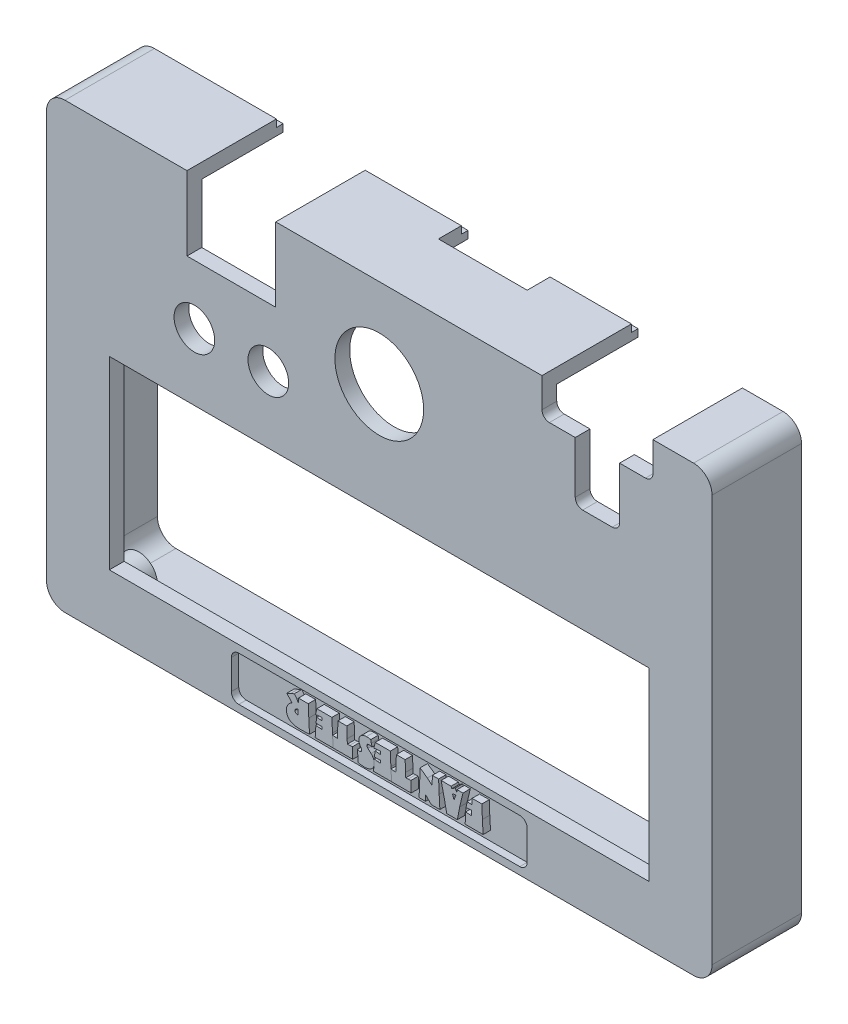
from build123d import *

# Parameters (mm, degrees)
SKETCH_1_W           = 90
SKETCH_1_H           = 60
EXTRUDE_1_DEPTH      = 2
SKETCH_8_W           = 2
SKETCH_8_H           = 60
EXTRUDE_8_DEPTH      = 11
SKETCH_9_W           = 88
SKETCH_9_H           = 2
EXTRUDE_9_DEPTH      = 11
SKETCH_10_W          = 2
SKETCH_10_H          = 58
EXTRUDE_10_DEPTH     = 11
SKETCH_11_W          = 86
SKETCH_11_H          = 2
EXTRUDE_11_DEPTH     = 11
SKETCH_12_W          = 0.8
SKETCH_12_H          = 60
EXTRUDE_12_DEPTH     = 1
SKETCH_23_W          = 90
SKETCH_23_H          = 1
CUT_EXTRUDE_8_DEPTH  = 0.9
SKETCH_24_W          = 1
SKETCH_24_H          = 59
CUT_EXTRUDE_9_DEPTH  = 0.9
SKETCH_25_W          = 89
SKETCH_25_H          = 1
CUT_EXTRUDE_10_DEPTH = 0.9
SKETCH_26_W          = 1
SKETCH_26_H          = 58
CUT_EXTRUDE_11_DEPTH = 0.9
SKETCH_27_W          = 15
SKETCH_27_H          = 13
CUT_EXTRUDE_12_DEPTH = 5
SKETCH_28_W          = 12
SKETCH_28_H          = 4
CUT_EXTRUDE_13_DEPTH = 20
SKETCH_29_W          = 12
SKETCH_29_H          = 13
CUT_EXTRUDE_14_DEPTH = 10
SKETCH_30_W          = 73
SKETCH_30_H          = 25
CUT_EXTRUDE_15_DEPTH = 10
SKETCH_31_R          = 2.5
EXTRUDE_22_DEPTH     = 3
SKETCH_32_R          = 1.4
CUT_EXTRUDE_16_DEPTH = 3
FILLET_4_R           = 2.5
FILLET_5_R           = 2.5
SKETCH_33_R          = 6
CUT_EXTRUDE_17_DEPTH = 5
SKETCH_34_R          = 2.75
CUT_EXTRUDE_18_DEPTH = 5
SKETCH_35_W          = 6
SKETCH_35_H          = 8
CUT_EXTRUDE_19_DEPTH = 5
FILLET_9_R           = 1
SKETCH_36_W          = 40
SKETCH_36_H          = 6
CUT_EXTRUDE_20_DEPTH = 1
FILLET_10_R          = 1
EXTRUDE_24_DEPTH     = 1
EXTRUDE_24_2_DEPTH   = 1
EXTRUDE_24_3_DEPTH   = 1
EXTRUDE_24_4_DEPTH   = 1
EXTRUDE_24_5_DEPTH   = 1
EXTRUDE_24_6_DEPTH   = 1
EXTRUDE_24_7_DEPTH   = 1
EXTRUDE_24_8_DEPTH   = 1
EXTRUDE_24_9_DEPTH   = 1


with BuildPart() as part:
    # Эскиз1 → Бобышка-Вытянуть1 (new body)
    with BuildSketch(Plane.XY):
        with Locations((11.347826087, -8.739130435)):
            Rectangle(SKETCH_1_W, SKETCH_1_H)
    extrude(amount=EXTRUDE_1_DEPTH)

    # Эскиз8 → Бобышка-Вытянуть8 (add)
    with BuildSketch(Plane(origin=(0, 0, 0), x_dir=(-1, 0, 0), z_dir=(0, 0, -1))):
        with Locations((-55.347826087, -8.739130435)):
            Rectangle(SKETCH_8_W, SKETCH_8_H)
    extrude(amount=EXTRUDE_8_DEPTH)

    # Эскиз9 → Бобышка-Вытянуть9 (add)
    with BuildSketch(Plane(origin=(0, 0, 0), x_dir=(-1, 0, 0), z_dir=(0, 0, -1))):
        with Locations((-10.347826087, -37.739130435)):
            Rectangle(SKETCH_9_W, SKETCH_9_H)
    extrude(amount=EXTRUDE_9_DEPTH)

    # Эскиз10 → Бобышка-Вытянуть10 (add)
    with BuildSketch(Plane(origin=(0, 0, 0), x_dir=(-1, 0, 0), z_dir=(0, 0, -1))):
        with Locations((32.652173913, -7.739130435)):
            Rectangle(SKETCH_10_W, SKETCH_10_H)
    extrude(amount=EXTRUDE_10_DEPTH)

    # Эскиз11 → Бобышка-Вытянуть11 (add)
    with BuildSketch(Plane(origin=(0, 0, 0), x_dir=(-1, 0, 0), z_dir=(0, 0, -1))):
        with Locations((-11.347826087, 20.260869565)):
            Rectangle(SKETCH_11_W, SKETCH_11_H)
    extrude(amount=EXTRUDE_11_DEPTH)

    # Эскиз12 → Бобышка-Вытянуть12 (add)
    with BuildSketch(Plane(origin=(0, 0, -11), x_dir=(-1, 0, 0), z_dir=(0, 0, -1))):
        with Locations((-55.947826087, -8.739130435)):
            Rectangle(SKETCH_12_W, SKETCH_12_H)
    extrude(amount=-EXTRUDE_12_DEPTH)

    # Эскиз23 → Вырез-Вытянуть8 (cut)
    with BuildSketch(Plane(origin=(0, 0, -11), x_dir=(-1, 0, 0), z_dir=(0, 0, -1))):
        with Locations((-11.347826087, 20.760869565)):
            Rectangle(SKETCH_23_W, SKETCH_23_H)
    extrude(amount=-CUT_EXTRUDE_8_DEPTH, mode=Mode.SUBTRACT)

    # Эскиз24 → Вырез-Вытянуть9 (cut)
    with BuildSketch(Plane(origin=(0, 0, -11), x_dir=(-1, 0, 0), z_dir=(0, 0, -1))):
        with Locations((33.152173913, -9.239130435)):
            Rectangle(SKETCH_24_W, SKETCH_24_H)
    extrude(amount=-CUT_EXTRUDE_9_DEPTH, mode=Mode.SUBTRACT)

    # Эскиз25 → Вырез-Вытянуть10 (cut)
    with BuildSketch(Plane(origin=(0, 0, -11), x_dir=(-1, 0, 0), z_dir=(0, 0, -1))):
        with Locations((-11.847826087, -38.239130435)):
            Rectangle(SKETCH_25_W, SKETCH_25_H)
    extrude(amount=-CUT_EXTRUDE_10_DEPTH, mode=Mode.SUBTRACT)

    # Эскиз26 → Вырез-Вытянуть11 (cut)
    with BuildSketch(Plane(origin=(0, 0, -11), x_dir=(-1, 0, 0), z_dir=(0, 0, -1))):
        with Locations((-55.847826087, -8.739130435)):
            Rectangle(SKETCH_26_W, SKETCH_26_H)
    extrude(amount=-CUT_EXTRUDE_11_DEPTH, mode=Mode.SUBTRACT)

    # Эскиз27 → Вырез-Вытянуть12 (cut)
    with BuildSketch(Plane(origin=(0, 21.260869565, 0), x_dir=(1, 0, 0), z_dir=(0, 1, 0))):
        with Locations((40.847826087, 4.5)):
            Rectangle(SKETCH_27_W, SKETCH_27_H)
    extrude(amount=-CUT_EXTRUDE_12_DEPTH, mode=Mode.SUBTRACT)

    # Эскиз28 → Вырез-Вытянуть13 (cut)
    with BuildSketch(Plane(origin=(0, 21.260869565, 0), x_dir=(1, 0, 0), z_dir=(0, 1, 0))):
        with Locations((16.347826087, 9)):
            Rectangle(SKETCH_28_W, SKETCH_28_H)
    extrude(amount=-CUT_EXTRUDE_13_DEPTH, mode=Mode.SUBTRACT)

    # Эскиз29 → Вырез-Вытянуть14 (cut)
    with BuildSketch(Plane(origin=(0, 21.260869565, 0), x_dir=(1, 0, 0), z_dir=(0, 1, 0))):
        with Locations((-8.652173913, 4.5)):
            Rectangle(SKETCH_29_W, SKETCH_29_H)
    extrude(amount=-CUT_EXTRUDE_14_DEPTH, mode=Mode.SUBTRACT)

    # Эскиз30 → Вырез-Вытянуть15 (cut)
    with BuildSketch(Plane.XY.offset(2)):
        with Locations((11.347826087, -18.239130435)):
            Rectangle(SKETCH_30_W, SKETCH_30_H)
    extrude(amount=-CUT_EXTRUDE_15_DEPTH, mode=Mode.SUBTRACT)

    # Эскиз31 → Бобышка-Вытянуть22 (add)
    with BuildSketch(Plane(origin=(0, 0, 0), x_dir=(-1, 0, 0), z_dir=(0, 0, -1))):
        with Locations(Location((26.152173913, -34.139130435, 0), (0, 0, 180))):
            Circle(SKETCH_31_R)
        with Locations(Location((-48.847826087, -34.139130435, 0), (0, 0, 180))):
            Circle(SKETCH_31_R)
        with Locations(Location((26.152173913, -2.739130435, 0), (0, 0, 180))):
            Circle(SKETCH_31_R)
        with Locations(Location((-48.847826087, -2.739130435, 0), (0, 0, 180))):
            Circle(SKETCH_31_R)
    extrude(amount=EXTRUDE_22_DEPTH)

    # Эскиз32 → Вырез-Вытянуть16 (cut)
    with BuildSketch(Plane(origin=(0, 0, -3), x_dir=(-1, 0, 0), z_dir=(0, 0, -1))):
        with Locations((26.152173913, -34.139130435)):
            Circle(SKETCH_32_R)
        with Locations((-48.847826087, -34.139130435)):
            Circle(SKETCH_32_R)
        with Locations((-48.847826087, -2.739130435)):
            Circle(SKETCH_32_R)
        with Locations((26.152173913, -2.739130435)):
            Circle(SKETCH_32_R)
    extrude(amount=-CUT_EXTRUDE_16_DEPTH, mode=Mode.SUBTRACT)

    # Скругление4
    fillet_4_edges = [part.edges().sort_by_distance(p)[0] for p in [
        (54.347826087, -36.739130435, -5.5),
        (-31.652173913, -36.739130435, -5.5),
        (54.347826087, 19.260869565, -5.5),
        (-31.652173913, 19.260869565, -5.5),
        (-33.652173913, 21.260869565, -4.05),
        (56.347826087, 21.260869565, -4.05),
        (56.347826087, -38.739130435, -4.05),
        (-33.652173913, -38.739130435, -4.05),
    ]]
    fillet(fillet_4_edges, radius=FILLET_4_R)

    # Скругление5
    fillet_5_edges = [part.edges().sort_by_distance(p)[0] for p in [
        (-32.652173913, 20.260869565, -10.55),
        (-32.652173913, -37.739130435, -10.55),
        (55.347826087, 20.260869565, -10.55),
        (55.347826087, -37.739130435, -10.55),
    ]]
    fillet(fillet_5_edges, radius=FILLET_5_R)

    # Эскиз33 → Вырез-Вытянуть17 (cut)
    with BuildSketch(Plane.XY.offset(2)):
        with Locations((11.347826087, 9.260869565)):
            Circle(SKETCH_33_R)
    extrude(amount=-CUT_EXTRUDE_17_DEPTH, mode=Mode.SUBTRACT)

    # Эскиз34 → Вырез-Вытянуть18 (cut)
    with BuildSketch(Plane.XY.offset(2)):
        with Locations((-3.652173913, 3.260869565)):
            Circle(SKETCH_34_R)
        with Locations((-13.652173913, 3.260869565)):
            Circle(SKETCH_34_R)
    extrude(amount=-CUT_EXTRUDE_18_DEPTH, mode=Mode.SUBTRACT)

    # Эскиз35 → Вырез-Вытянуть19 (cut)
    with BuildSketch(Plane.XY.offset(2)):
        with Locations((40.847826087, 12.260869565)):
            Rectangle(SKETCH_35_W, SKETCH_35_H)
    extrude(amount=-CUT_EXTRUDE_19_DEPTH, mode=Mode.SUBTRACT)

    # Скругление9
    fillet_9_edges = [part.edges().sort_by_distance(p)[0] for p in [
        (48.347826087, 16.260869565, 1),
        (33.347826087, 16.260869565, 1),
        (43.847826087, 8.260869565, 1),
        (37.847826087, 8.260869565, 1),
    ]]
    fillet(fillet_9_edges, radius=FILLET_9_R)

    # Эскиз36 → Вырез-Вытянуть20 (cut)
    with BuildSketch(Plane.XY.offset(2)):
        with Locations((11.347826087, -34.739130435)):
            Rectangle(SKETCH_36_W, SKETCH_36_H)
    extrude(amount=-CUT_EXTRUDE_20_DEPTH, mode=Mode.SUBTRACT)

    # Скругление10
    fillet_10_edges = [part.edges().sort_by_distance(p)[0] for p in [
        (31.347826087, -31.739130435, 1.5),
        (31.347826087, -37.739130435, 1.5),
        (-8.652173913, -37.739130435, 1.5),
        (-8.652173913, -31.739130435, 1.5),
    ]]
    fillet(fillet_10_edges, radius=FILLET_10_R)


with BuildPart() as body_2:
    # Бобышка-Вытянуть24: read off the stored shape, not the designer's step
    # Бобышка-Вытянуть24 outline → Бобышка-Вытянуть24 (new body)
    with BuildSketch(Plane.XY.offset(1)):
        with BuildLine():
            Line((23.05076574, -34.971281843), (22.960064521, -36.465184282))
            Line((22.960064521, -36.465184282), (25.39299135, -36.465184282))
            add(Edge.make_bspline(
                [(25.291619399, -34.748530318), (25.293236653, -34.801223513), (25.296635801, -34.911974158), (25.30534041, -35.085995763), (25.314058626, -35.276124742), (25.326798719, -35.482362723), (25.339508144, -35.705181218), (25.356143815, -35.94409354), (25.37296666, -36.199369208), (25.386176061, -36.374715638), (25.39299135, -36.465184282)],
                knots=[0, 0, 0, 0, 0.091960342, 0.193282399, 0.303937941, 0.423970493, 0.553726848, 0.693256889, 0.841738249, 1, 1, 1, 1], degree=3))
            Line((25.291619399, -34.748530318), (25.220925801, -32.965184282))
            Line((25.220925801, -32.965184282), (23.901089673, -32.965184282))
            Line((23.901089673, -32.965184282), (23.883749734, -33.735477727))
            add(Edge.make_bspline(
                [(23.6156476, -33.724806995), (23.642983947, -33.726724268), (23.69451953, -33.730338788), (23.766579743, -33.733318664), (23.828600451, -33.735890131), (23.866407815, -33.735607409), (23.883749734, -33.735477727)],
                knots=[0, 0, 0, 0, 0.306294033, 0.57743785, 0.806174296, 1, 1, 1, 1], degree=3))
            add(Edge.make_bspline(
                [(23.225498972, -33.684791751), (23.252182635, -33.687166768), (23.309360947, -33.692256005), (23.400893179, -33.701970465), (23.504319147, -33.712356403), (23.577196573, -33.720506764), (23.6156476, -33.724806995)],
                knots=[0, 0, 0, 0, 0.204909238, 0.439083791, 0.704053702, 1, 1, 1, 1], degree=3))
            add(Edge.make_bspline(
                [(23.162808423, -34.05760044), (23.167240568, -34.032477476), (23.176809618, -33.978236723), (23.192522429, -33.891007141), (23.207944236, -33.791685875), (23.219440114, -33.721685289), (23.225498972, -33.684791751)],
                knots=[0, 0, 0, 0, 0.202441277, 0.437072922, 0.703311467, 1, 1, 1, 1], degree=3))
            add(Edge.make_bspline(
                [(23.088113301, -34.449749831), (23.092961718, -34.422176188), (23.10329214, -34.363425591), (23.120576559, -34.270486772), (23.140754286, -34.167366889), (23.155216608, -34.09538594), (23.162808423, -34.05760044)],
                knots=[0, 0, 0, 0, 0.210387918, 0.448269241, 0.710375835, 1, 1, 1, 1], degree=3))
            add(Edge.make_bspline(
                [(23.851070618, -34.414403032), (23.83550864, -34.414336065), (23.799711206, -34.414182019), (23.739234159, -34.415718067), (23.664780833, -34.418689509), (23.576480852, -34.421506559), (23.474052022, -34.427577265), (23.357724754, -34.432905418), (23.227513584, -34.441541702), (23.13613514, -34.446922222), (23.088113301, -34.449749831)],
                knots=[0, 0, 0, 0, 0.061114662, 0.140582909, 0.237556205, 0.353756089, 0.487517756, 0.64050633, 0.811076376, 1, 1, 1, 1], degree=3))
            Line((23.851070618, -34.414403032), (23.817057661, -35.056647696))
            add(Edge.make_bspline(
                [(23.510941045, -35.04130852), (23.562947759, -35.044683352), (23.664911587, -35.051300013), (23.767026515, -35.054889184), (23.817057661, -35.056647696)],
                knots=[0, 0, 0, 0, 0.510050625, 1, 1, 1, 1], degree=3))
            add(Edge.make_bspline(
                [(23.05076574, -34.971281843), (23.082125776, -34.975628469), (23.14958169, -34.984978128), (23.257475802, -35.002194311), (23.379610224, -35.020515387), (23.465600388, -35.034129898), (23.510941045, -35.04130852)],
                knots=[0, 0, 0, 0, 0.204041418, 0.438896198, 0.704142728, 1, 1, 1, 1], degree=3))
        make_face()
    extrude(amount=EXTRUDE_24_DEPTH)


with BuildPart() as body_3:
    # Extrude 24 2 outline → Extrude 24 2 (new body)
    with BuildSketch(Plane.XY.offset(1)):
        with BuildLine():
            add(Edge.make_bspline(
                [(20.129652935, -34.803884739), (20.116766445, -34.745861035), (20.089754464, -34.624234808), (20.047321155, -34.43388352), (20.000142174, -34.228016288), (19.951373856, -34.005872753), (19.896754136, -33.768511569), (19.840522718, -33.51465659), (19.779682296, -33.245254151), (19.737740853, -33.060328227), (19.716162082, -32.965184282)],
                knots=[0, 0, 0, 0, 0.0946144, 0.198325714, 0.310443765, 0.430813265, 0.560357588, 0.698153136, 0.84470051, 1, 1, 1, 1], degree=3))
            add(Edge.make_bspline(
                [(20.477785557, -36.465184282), (20.474722142, -36.448057459), (20.468150466, -36.411316794), (20.456595261, -36.352932946), (20.444195001, -36.287477247), (20.429183913, -36.215339131), (20.413224848, -36.135966318), (20.396148352, -36.049390115), (20.376532599, -35.956122645), (20.355996607, -35.855787506), (20.333336441, -35.748408467), (20.308369917, -35.634299507), (20.283506952, -35.512675141), (20.25489607, -35.384675323), (20.226759575, -35.249079311), (20.195853555, -35.106850672), (20.16313973, -34.957738981), (20.140975892, -34.855907783), (20.129652935, -34.803884739)],
                knots=[0, 0, 0, 0, 0.030749035, 0.065963194, 0.105184053, 0.148488334, 0.196184446, 0.24827254, 0.304445785, 0.364625718, 0.429277235, 0.498401387, 0.571066046, 0.648669869, 0.730197602, 0.815813943, 0.905903893, 1, 1, 1, 1], degree=3))
            Line((20.477785557, -36.465184282), (21.908330527, -36.465184282))
            add(Edge.make_bspline(
                [(22.219115588, -34.825893123), (22.189694228, -34.965440029), (22.131338089, -35.242225962), (22.049797818, -35.654967212), (21.975808037, -36.061919478), (21.930695565, -36.33152445), (21.908330527, -36.465184282)],
                knots=[0, 0, 0, 0, 0.256398193, 0.508555978, 0.756360854, 1, 1, 1, 1], degree=3))
            add(Edge.make_bspline(
                [(22.661284033, -32.965184282), (22.654994714, -32.990956492), (22.641993674, -33.04423182), (22.623120729, -33.127147101), (22.601258906, -33.214950524), (22.579679801, -33.308252471), (22.55611615, -33.406459542), (22.531538569, -33.509855682), (22.505356677, -33.618247796), (22.478956205, -33.732240239), (22.449981437, -33.850997905), (22.420927031, -33.97516715), (22.390025989, -34.104274449), (22.357978885, -34.238487223), (22.325663216, -34.37828722), (22.290486931, -34.522785805), (22.255544311, -34.672769264), (22.23138322, -34.774327572), (22.219115588, -34.825893123)],
                knots=[0, 0, 0, 0, 0.041612251, 0.086019254, 0.133382434, 0.183539943, 0.236233463, 0.291802359, 0.350246648, 0.411146484, 0.475341601, 0.541992028, 0.611178524, 0.683579621, 0.758436527, 0.836249204, 0.91685663, 1, 1, 1, 1], degree=3))
            Line((22.661284033, -32.965184282), (21.870316045, -32.965184282))
            Line((21.870316045, -32.965184282), (21.810293179, -33.402017361))
            add(Edge.make_bspline(
                [(21.78361635, -33.197939617), (21.789421973, -33.212017247), (21.801557549, -33.241443911), (21.810878872, -33.290448921), (21.814160469, -33.344662677), (21.811626855, -33.382237988), (21.810293179, -33.402017361)],
                knots=[0, 0, 0, 0, 0.218990593, 0.457759064, 0.714568282, 1, 1, 1, 1], degree=3))
            Line((21.78361635, -33.197939617), (21.621554612, -32.901159892))
            add(Edge.make_bspline(
                [(21.301432661, -33.119909892), (21.320770649, -33.106789828), (21.364345003, -33.077226344), (21.437226925, -33.027926369), (21.524356289, -32.967778621), (21.587527641, -32.924481627), (21.621554612, -32.901159892)],
                knots=[0, 0, 0, 0, 0.180813759, 0.407428244, 0.680813825, 1, 1, 1, 1], degree=3))
            add(Edge.make_bspline(
                [(21.133970284, -33.232988478), (21.13420907, -33.23263586), (21.137665707, -33.227772388), (21.146398113, -33.220716735), (21.16317374, -33.205571064), (21.188343989, -33.190135163), (21.219164406, -33.168954483), (21.25794602, -33.145696721), (21.286084631, -33.129011009), (21.301432661, -33.119909892)],
                knots=[0.057959926, 0.057959926, 0.057959926, 0.057959926, 0.06301111, 0.12883402, 0.230143345, 0.368701917, 0.543404953, 0.750953076, 1, 1, 1, 1], degree=3))
            Line((21.133970284, -33.232988478), (21.058006594, -32.965184282))
            Line((21.058006594, -32.965184282), (19.716162082, -32.965184282))
        make_face()
        with BuildLine():
            add(Edge.make_bspline(
                [(21.498174277, -33.713469343), (21.453377594, -33.71950414), (21.365134341, -33.731391854), (21.278206457, -33.750664772), (21.235407508, -33.760153794)],
                knots=[0, 0, 0, 0, 0.50764995, 1, 1, 1, 1], degree=3))
            add(Edge.make_bspline(
                [(21.701065036, -33.692365644), (21.699686371, -33.692437287), (21.689196199, -33.691399274), (21.680971143, -33.695412875), (21.656735916, -33.695797622), (21.628770452, -33.700017111), (21.591659317, -33.703651465), (21.54757246, -33.708477675), (21.515528534, -33.711715702), (21.498174277, -33.713469343)],
                knots=[0.018867888, 0.018867888, 0.018867888, 0.018867888, 0.037075841, 0.105681148, 0.209625671, 0.352841246, 0.531771228, 0.746418023, 1, 1, 1, 1], degree=3))
            add(Edge.make_bspline(
                [(21.565533271, -34.090946477), (21.575344196, -34.063168471), (21.596276355, -34.003902534), (21.628907973, -33.90947862), (21.664020029, -33.804308924), (21.688362683, -33.730751412), (21.701065036, -33.692365644)],
                knots=[0, 0, 0, 0, 0.209101977, 0.446130815, 0.709093978, 0.996083324, 0.996083324, 0.996083324, 0.996083324], degree=3))
            add(Edge.make_bspline(
                [(21.46482824, -34.484429709), (21.46458413, -34.474858457), (21.464048497, -34.453856965), (21.469003202, -34.419347152), (21.476134281, -34.379050493), (21.487167522, -34.33283768), (21.501045891, -34.280691376), (21.519436511, -34.222825849), (21.540558893, -34.158636689), (21.556939851, -34.114237964), (21.565533271, -34.090946477)],
                knots=[0, 0, 0, 0, 0.070273521, 0.154196003, 0.255494251, 0.37125073, 0.503262761, 0.652133715, 0.817510001, 1, 1, 1, 1], degree=3))
            add(Edge.make_bspline(
                [(21.360121685, -34.10295105), (21.369204409, -34.129120772), (21.38848136, -34.184662749), (21.415096858, -34.274510244), (21.440860248, -34.375564085), (21.456594798, -34.447032383), (21.46482824, -34.484429709)],
                knots=[0, 0, 0, 0, 0.209895812, 0.445477739, 0.709834289, 1, 1, 1, 1], degree=3))
            add(Edge.make_bspline(
                [(21.235407508, -33.760153794), (21.238545962, -33.767479057), (21.245651384, -33.784063363), (21.256879289, -33.812122017), (21.270305256, -33.846018567), (21.284957833, -33.88605337), (21.300466746, -33.932182), (21.319841034, -33.983573275), (21.339381752, -34.041319948), (21.353014162, -34.081830225), (21.360121685, -34.10295105)],
                knots=[0, 0, 0, 0, 0.065521169, 0.148339132, 0.248468868, 0.365276962, 0.498806908, 0.648564343, 0.816772146, 1, 1, 1, 1], degree=3))
        make_face(mode=Mode.SUBTRACT)
    extrude(amount=EXTRUDE_24_2_DEPTH)


with BuildPart() as body_4:
    # Extrude 24 3 outline → Extrude 24 3 (new body)
    with BuildSketch(Plane.XY.offset(1)):
        with BuildLine():
            add(Edge.make_bspline(
                [(16.728357204, -36.465184282), (16.730763024, -36.420720741), (16.735923781, -36.32534143), (16.745061631, -36.172665766), (16.753102168, -36.000543365), (16.763697175, -35.808967404), (16.773337607, -35.597745803), (16.783852458, -35.366973991), (16.796286366, -35.11691925), (16.803816065, -34.943720265), (16.807720771, -34.853903794)],
                knots=[0, 0, 0, 0, 0.082805565, 0.177627279, 0.284420571, 0.403229177, 0.534424567, 0.677614867, 0.832819489, 1, 1, 1, 1], degree=3))
            Line((16.728357204, -36.465184282), (17.617362539, -36.465184282))
            add(Edge.make_bspline(
                [(17.59068571, -36.046358062), (17.591947037, -36.072594391), (17.594748624, -36.130869017), (17.601138754, -36.22687152), (17.60818937, -36.340281773), (17.614162915, -36.421617975), (17.617362539, -36.465184282)],
                knots=[0, 0, 0, 0, 0.187755668, 0.417032101, 0.687743494, 1, 1, 1, 1], degree=3))
            add(Edge.make_bspline(
                [(17.58201574, -35.654208672), (17.582194376, -35.691778868), (17.582535802, -35.763586915), (17.583711394, -35.866525203), (17.586177226, -35.959696044), (17.589240298, -36.01857437), (17.59068571, -36.046358062)],
                knots=[0, 0, 0, 0, 0.287313968, 0.549144191, 0.787248722, 1, 1, 1, 1], degree=3))
            Line((17.58201574, -35.654208672), (18.392324429, -36.465184282))
            Line((18.392324429, -36.465184282), (19.545430374, -36.465184282))
            add(Edge.make_bspline(
                [(19.446726106, -34.707848154), (19.450723407, -34.790768726), (19.458589714, -34.953948485), (19.470269709, -35.1947364), (19.483460226, -35.426995942), (19.494870307, -35.650917063), (19.508158498, -35.866272122), (19.519579605, -36.073523573), (19.532506732, -36.272238738), (19.541186737, -36.401828239), (19.545430374, -36.465184282)],
                knots=[0, 0, 0, 0, 0.141495222, 0.27844907, 0.410881977, 0.537997522, 0.660594692, 0.778630676, 0.891772989, 1, 1, 1, 1], degree=3))
            add(Edge.make_bspline(
                [(19.373364826, -32.965184282), (19.3739848, -32.98674969), (19.375276046, -33.031664866), (19.378261151, -33.102117058), (19.380575516, -33.178389704), (19.384268173, -33.260621091), (19.387266782, -33.34867677), (19.391608133, -33.442689804), (19.395277028, -33.542750996), (19.400278334, -33.64876792), (19.404634323, -33.760833647), (19.410211459, -33.878636027), (19.415545139, -34.002461472), (19.420682912, -34.13208404), (19.42672333, -34.267690568), (19.433563153, -34.409059498), (19.44018949, -34.556451323), (19.444518495, -34.656716898), (19.446726106, -34.707848154)],
                knots=[0, 0, 0, 0, 0.037106718, 0.077283708, 0.121281775, 0.168350977, 0.218858779, 0.272820422, 0.330220385, 0.391074618, 0.455366946, 0.523113874, 0.593916702, 0.66853975, 0.74623521, 0.827385799, 0.911973966, 1, 1, 1, 1], degree=3))
            Line((19.373364826, -32.965184282), (18.523040893, -32.965184282))
            Line((18.523040893, -32.965184282), (18.50236635, -34.160306233))
            add(Edge.make_bspline(
                [(17.846783271, -33.620767361), (17.868877047, -33.63665828), (17.915048523, -33.669867052), (17.98543317, -33.724105786), (18.060805444, -33.783455914), (18.140763213, -33.847981527), (18.22478978, -33.918294257), (18.31369548, -33.993646627), (18.406801665, -34.074850968), (18.469970643, -34.131337543), (18.50236635, -34.160306233)],
                knots=[0, 0, 0, 0, 0.09610945, 0.200849099, 0.313781344, 0.434927125, 0.563699269, 0.700720671, 0.846516982, 1, 1, 1, 1], degree=3))
            add(Edge.make_bspline(
                [(16.860407508, -32.922501355), (16.89452008, -32.9434631), (16.965461557, -32.987055744), (17.073432727, -33.057799917), (17.188022948, -33.13449249), (17.307849631, -33.218964738), (17.434453267, -33.309217285), (17.566772993, -33.407074008), (17.705006011, -33.51140469), (17.798830789, -33.583778273), (17.846783271, -33.620767361)],
                knots=[0, 0, 0, 0, 0.099334689, 0.206579257, 0.320242844, 0.441432714, 0.570311398, 0.706002116, 0.84974195, 1, 1, 1, 1], degree=3))
            add(Edge.make_bspline(
                [(16.807720771, -34.853903794), (16.810172808, -34.783877393), (16.815177958, -34.640938062), (16.822709637, -34.422200712), (16.829168823, -34.194322037), (16.835802117, -33.957564469), (16.84272199, -33.711482323), (16.848442795, -33.456483341), (16.854525207, -33.192384668), (16.858425755, -33.01342532), (16.860407508, -32.922501355)],
                knots=[0, 0, 0, 0, 0.108795459, 0.222075528, 0.339829785, 0.462759491, 0.589829682, 0.722067057, 0.858790471, 1, 1, 1, 1], degree=3))
        make_face()
    extrude(amount=EXTRUDE_24_3_DEPTH)


with BuildPart() as body_5:
    # Extrude 24 4 outline → Extrude 24 4 (new body)
    with BuildSketch(Plane.XY.offset(1)):
        with BuildLine():
            Line((12.890228393, -35.01396477), (12.844210862, -36.465184282))
            Line((12.844210862, -36.465184282), (15.661284033, -36.465184282))
            Line((15.661284033, -36.465184282), (15.617267265, -35.01396477))
            Line((15.617267265, -35.01396477), (15.243791655, -35.044643123))
            Line((15.243791655, -35.044643123), (14.933673515, -35.056647696))
            add(Edge.make_bspline(
                [(14.900327478, -34.436411416), (14.903277681, -34.491540355), (14.909058837, -34.599569869), (14.91652336, -34.758127181), (14.92569605, -34.909689067), (14.931054688, -35.00840441), (14.933673515, -35.056647696)],
                knots=[0, 0, 0, 0, 0.266646778, 0.522515435, 0.766647978, 1, 1, 1, 1], degree=3))
            add(Edge.make_bspline(
                [(14.848974582, -32.965184282), (14.850296017, -33.008979127), (14.85309323, -33.101683994), (14.857777415, -33.248183879), (14.863101464, -33.409579225), (14.869190127, -33.585865538), (14.875588479, -33.777290133), (14.884069259, -33.983779067), (14.891736509, -34.205217503), (14.897403225, -34.357716036), (14.900327478, -34.436411416)],
                knots=[0, 0, 0, 0, 0.089288672, 0.189006132, 0.298699745, 0.41836965, 0.548468711, 0.689013787, 0.839518599, 1, 1, 1, 1], degree=3))
            Line((14.848974582, -32.965184282), (13.657854155, -32.965184282))
            add(Edge.make_bspline(
                [(13.602499734, -34.455085196), (13.604033435, -34.411289945), (13.607279949, -34.318584832), (13.612904186, -34.171657772), (13.617752638, -34.008896652), (13.624767194, -33.830403932), (13.631998878, -33.63632635), (13.640052641, -33.426692751), (13.648710567, -33.20127311), (13.654737406, -33.045659214), (13.657854155, -32.965184282)],
                knots=[0, 0, 0, 0, 0.088177305, 0.186652359, 0.295856657, 0.415821369, 0.54608394, 0.686644397, 0.837949748, 1, 1, 1, 1], degree=3))
            add(Edge.make_bspline(
                [(13.573822143, -35.056647696), (13.574533481, -35.046646401), (13.57625537, -35.022436961), (13.577912783, -34.979722305), (13.5807424, -34.92415446), (13.584034164, -34.855459142), (13.587992654, -34.773648324), (13.592867402, -34.678965472), (13.597281911, -34.571346978), (13.600693931, -34.4953215), (13.602499734, -34.455085196)],
                knots=[0, 0, 0, 0, 0.049942555, 0.120892468, 0.212911386, 0.327105472, 0.463474734, 0.620913136, 0.799369179, 1, 1, 1, 1], degree=3))
            add(Edge.make_bspline(
                [(13.263704002, -35.044643123), (13.285269628, -35.045487654), (13.331073674, -35.047281386), (13.404174953, -35.051111587), (13.486022579, -35.053213081), (13.543591037, -35.055465091), (13.573822143, -35.056647696)],
                knots=[0, 0, 0, 0, 0.208620635, 0.443097244, 0.707551903, 1, 1, 1, 1], degree=3))
            add(Edge.make_bspline(
                [(12.890228393, -35.01396477), (12.950939014, -35.018156582), (13.075563701, -35.026761391), (13.19992501, -35.03858127), (13.263704002, -35.044643123)],
                knots=[0, 0, 0, 0, 0.487147628, 1, 1, 1, 1], degree=3))
        make_face()
    extrude(amount=EXTRUDE_24_4_DEPTH)


with BuildPart() as body_6:
    # Extrude 24 5 outline → Extrude 24 5 (new body)
    with BuildSketch(Plane.XY.offset(1)):
        with BuildLine():
            Line((10.67271696, -34.971281843), (10.58201574, -36.465184282))
            Line((10.58201574, -36.465184282), (13.014942569, -36.465184282))
            add(Edge.make_bspline(
                [(12.916905222, -34.748530318), (12.918883585, -34.800995423), (12.923041865, -34.91127075), (12.930058391, -35.084931913), (12.940577058, -35.274960218), (12.951861956, -35.48148478), (12.96413815, -35.704289044), (12.98007634, -35.943205704), (12.996388243, -36.198674774), (13.008628386, -36.374489001), (13.014942569, -36.465184282)],
                knots=[0, 0, 0, 0, 0.091599107, 0.192530286, 0.303220495, 0.423634611, 0.553385903, 0.69252242, 0.841385046, 1, 1, 1, 1], degree=3))
            Line((12.916905222, -34.748530318), (12.8422101, -32.965184282))
            Line((12.8422101, -32.965184282), (10.805434185, -32.965184282))
            add(Edge.make_bspline(
                [(10.716733728, -33.343328337), (10.722777999, -33.318439931), (10.735935899, -33.26425984), (10.75632025, -33.176104925), (10.780662637, -33.075136863), (10.796864525, -33.003222127), (10.805434185, -32.965184282)],
                knots=[0, 0, 0, 0, 0.197818234, 0.430634645, 0.698845708, 1, 1, 1, 1], degree=3))
            add(Edge.make_bspline(
                [(10.624698667, -33.733476965), (10.629504815, -33.709672321), (10.64030957, -33.656156841), (10.660455105, -33.567415735), (10.686815867, -33.461285144), (10.706248579, -33.384668012), (10.716733728, -33.343328337)],
                knots=[0, 0, 0, 0, 0.181718759, 0.408523933, 0.680862121, 1, 1, 1, 1], degree=3))
            add(Edge.make_bspline(
                [(10.992838911, -33.677455623), (10.985270651, -33.678035583), (10.967855786, -33.679370095), (10.93863134, -33.683968815), (10.90254512, -33.688281502), (10.859820608, -33.694283603), (10.810529803, -33.702473149), (10.754575631, -33.711993826), (10.691742365, -33.721579777), (10.64780226, -33.729377134), (10.624698667, -33.733476965)],
                knots=[0, 0, 0, 0, 0.061115878, 0.140630051, 0.238129788, 0.353853759, 0.488086745, 0.64056924, 0.811012235, 1, 1, 1, 1], degree=3))
            add(Edge.make_bspline(
                [(11.52104013, -33.648111111), (11.512592298, -33.648324252), (11.491691401, -33.648851587), (11.454548609, -33.650088013), (11.405887948, -33.653064198), (11.345638397, -33.656304292), (11.27383638, -33.660364202), (11.190445234, -33.664817794), (11.095551687, -33.671122941), (11.028409832, -33.675262524), (10.992838911, -33.677455623)],
                knots=[0, 0, 0, 0, 0.047920374, 0.118560441, 0.21072419, 0.324355486, 0.460713042, 0.618538187, 0.797906271, 1, 1, 1, 1], degree=3))
            Line((11.52104013, -33.648111111), (11.509702478, -34.032924373))
            add(Edge.make_bspline(
                [(11.232930374, -34.024254404), (11.276264439, -34.02718196), (11.368412633, -34.033407295), (11.460774931, -34.033091605), (11.509702478, -34.032924373)],
                knots=[0, 0, 0, 0, 0.470264935, 1, 1, 1, 1], degree=3))
            add(Edge.make_bspline(
                [(10.81010263, -33.946891599), (10.838339593, -33.952205261), (10.8994839, -33.963711462), (10.998036675, -33.982766793), (11.110922199, -34.002256554), (11.190702106, -34.016640724), (11.232930374, -34.024254404)],
                knots=[0, 0, 0, 0, 0.200529291, 0.434226048, 0.700530435, 1, 1, 1, 1], degree=3))
            add(Edge.make_bspline(
                [(10.747412082, -34.331704861), (10.752333828, -34.30614619), (10.762977965, -34.250871096), (10.779465046, -34.161456281), (10.79400821, -34.058505789), (10.804525479, -33.985568931), (10.81010263, -33.946891599)],
                knots=[0, 0, 0, 0, 0.200244429, 0.43306358, 0.699362036, 1, 1, 1, 1], degree=3))
            add(Edge.make_bspline(
                [(10.667381594, -34.726521934), (10.672016579, -34.702061726), (10.682390291, -34.647316541), (10.700356146, -34.55704851), (10.722560276, -34.449935448), (10.738721507, -34.373049612), (10.747412082, -34.331704861)],
                knots=[0, 0, 0, 0, 0.185391939, 0.414931706, 0.685384151, 1, 1, 1, 1], degree=3))
            add(Edge.make_bspline(
                [(11.499031746, -34.711849678), (11.482581399, -34.711582406), (11.444347447, -34.710961211), (11.379206426, -34.711144338), (11.298508042, -34.711808273), (11.202249813, -34.713254667), (11.09041766, -34.715003623), (10.963059025, -34.718896887), (10.820312523, -34.721678466), (10.720065415, -34.724853387), (10.667381594, -34.726521934)],
                knots=[0, 0, 0, 0, 0.059334577, 0.137905626, 0.234920132, 0.350382604, 0.485097305, 0.638283138, 0.809903478, 1, 1, 1, 1], degree=3))
            Line((11.499031746, -34.711849678), (11.481691807, -35.056647696))
            add(Edge.make_bspline(
                [(11.136226868, -35.029303946), (11.16845313, -35.032715013), (11.230641557, -35.039297498), (11.320432426, -35.04755603), (11.403414521, -35.052659656), (11.456346837, -35.055356431), (11.481691807, -35.056647696)],
                knots=[0, 0, 0, 0, 0.280484359, 0.541262951, 0.780348226, 1, 1, 1, 1], degree=3))
            add(Edge.make_bspline(
                [(10.67271696, -34.971281843), (10.702286217, -34.974594521), (10.767671166, -34.981919672), (10.874649327, -34.994437623), (10.999570888, -35.010604581), (11.088661587, -35.022795336), (11.136226868, -35.029303946)],
                knots=[0, 0, 0, 0, 0.191081649, 0.422528834, 0.691689724, 1, 1, 1, 1], degree=3))
        make_face()
    extrude(amount=EXTRUDE_24_5_DEPTH)


with BuildPart() as body_7:
    # Extrude 24 6 outline → Extrude 24 6 (new body)
    with BuildSketch(Plane.XY.offset(1)):
        with BuildLine():
            add(Edge.make_bspline(
                [(8.405186472, -34.971281843), (8.426288662, -34.978005384), (8.466421469, -34.990792427), (8.523778802, -35.0081453), (8.575121851, -35.022882606), (8.620466366, -35.0349457), (8.659809072, -35.044411233), (8.693162242, -35.051118683), (8.720523346, -35.055578212), (8.736856996, -35.05632286), (8.743982204, -35.056647696)],
                knots=[0, 0, 0, 0, 0.189753534, 0.360879217, 0.513409205, 0.647389047, 0.762886241, 0.860006826, 0.938930949, 1, 1, 1, 1], degree=3))
            Line((8.405186472, -34.971281843), (8.493220008, -36.478522696))
            add(Edge.make_bspline(
                [(9.307530222, -36.593233062), (9.278400238, -36.592787157), (9.218762177, -36.591874253), (9.127353136, -36.586206041), (9.031672269, -36.577705524), (8.932089073, -36.564762141), (8.828177797, -36.548864222), (8.720207651, -36.528495398), (8.607851395, -36.50546013), (8.531859876, -36.487602748), (8.493220008, -36.478522696)],
                knots=[0, 0, 0, 0, 0.106033536, 0.217083354, 0.333276729, 0.455627218, 0.582548508, 0.715868421, 0.855525897, 1, 1, 1, 1], degree=3))
            add(Edge.make_bspline(
                [(10.252556899, -36.341803946), (10.222008955, -36.361957017), (10.160152763, -36.402764746), (10.059456831, -36.45380068), (9.951683394, -36.497281648), (9.836705971, -36.532393112), (9.714548868, -36.559909397), (9.585201934, -36.578600065), (9.448718622, -36.591147608), (9.355355793, -36.592526644), (9.307530222, -36.593233062)],
                knots=[0, 0, 0, 0, 0.110462575, 0.223674437, 0.340254959, 0.461102197, 0.586367838, 0.718075714, 0.855582889, 1, 1, 1, 1], degree=3))
            add(Edge.make_bspline(
                [(10.667381594, -35.482810044), (10.666133413, -35.528679252), (10.663704084, -35.617954323), (10.64392691, -35.747430124), (10.612327342, -35.868525234), (10.566533189, -35.981042422), (10.5075532, -36.085075076), (10.435436774, -36.180367112), (10.35100444, -36.26780446), (10.285737388, -36.316863362), (10.252556899, -36.341803946)],
                knots=[0, 0, 0, 0, 0.138338996, 0.269248681, 0.394204378, 0.515151299, 0.634706388, 0.753967581, 0.874921942, 1, 1, 1, 1], degree=3))
            add(Edge.make_bspline(
                [(10.23588388, -34.550454861), (10.270371779, -34.583128718), (10.337881829, -34.64708778), (10.425679412, -34.752876058), (10.499963614, -34.863099315), (10.561316101, -34.977855506), (10.608937804, -35.097309578), (10.643246069, -35.221580969), (10.663583065, -35.350753022), (10.66610703, -35.438499459), (10.667381594, -35.482810044)],
                knots=[0, 0, 0, 0, 0.134418573, 0.263124306, 0.388296854, 0.51022411, 0.630849495, 0.751640636, 0.874582386, 1, 1, 1, 1], degree=3))
            add(Edge.make_bspline(
                [(9.80705385, -34.163640837), (9.878227424, -34.227626023), (10.021385774, -34.356325667), (10.164114922, -34.48550114), (10.23588388, -34.550454861)],
                knots=[0, 0, 0, 0, 0.497166766, 1, 1, 1, 1], degree=3))
            add(Edge.make_bspline(
                [(9.685674277, -33.860191904), (9.686904603, -33.887736457), (9.689351626, -33.942520431), (9.714755781, -34.021446006), (9.751599674, -34.097505984), (9.788240121, -34.141203514), (9.80705385, -34.163640837)],
                knots=[0, 0, 0, 0, 0.246415164, 0.490100603, 0.738182522, 1, 1, 1, 1], degree=3))
            add(Edge.make_bspline(
                [(9.985788606, -33.648111111), (9.962411022, -33.6486845), (9.918303244, -33.649766346), (9.856723095, -33.659382819), (9.804431861, -33.675946776), (9.760800962, -33.698663447), (9.72634206, -33.729082236), (9.702534657, -33.767161759), (9.687851351, -33.811579619), (9.686426494, -33.843395514), (9.685674277, -33.860191904)],
                knots=[0, 0, 0, 0, 0.167915516, 0.316815479, 0.446134649, 0.560490036, 0.667943144, 0.772079926, 0.879675419, 1, 1, 1, 1], degree=3))
            add(Edge.make_bspline(
                [(10.368601106, -33.733476965), (10.343717547, -33.726751509), (10.296451787, -33.713976657), (10.229283805, -33.696746348), (10.169743935, -33.681896149), (10.117929995, -33.669939272), (10.073923255, -33.660482751), (10.037699422, -33.653714688), (10.009235369, -33.649281827), (9.992689524, -33.64845568), (9.985788606, -33.648111111)],
                knots=[0, 0, 0, 0, 0.196910442, 0.374026957, 0.529721487, 0.665667272, 0.780246429, 0.873511744, 0.94724445, 1, 1, 1, 1], degree=3))
            add(Edge.make_bspline(
                [(10.272564521, -33.324654556), (10.278798327, -33.349772805), (10.292746627, -33.405975523), (10.315584823, -33.498981319), (10.340613539, -33.610314528), (10.358801749, -33.690353792), (10.368601106, -33.733476965)],
                knots=[0, 0, 0, 0, 0.184875205, 0.413662963, 0.684096127, 1, 1, 1, 1], degree=3))
            add(Edge.make_bspline(
                [(10.191867112, -32.943175898), (10.196956418, -32.967856939), (10.208147772, -33.022130411), (10.226917497, -33.110319473), (10.248030996, -33.212945874), (10.264024771, -33.285770449), (10.272564521, -33.324654556)],
                knots=[0, 0, 0, 0, 0.193886097, 0.426354439, 0.693706478, 1, 1, 1, 1], degree=3))
            add(Edge.make_bspline(
                [(9.614313758, -32.879818428), (9.644775563, -32.879794195), (9.703718979, -32.879747304), (9.789516636, -32.883714359), (9.869878905, -32.887621398), (9.944757409, -32.895443479), (10.01421054, -32.903807184), (10.078406127, -32.914205708), (10.137076728, -32.927618936), (10.174122235, -32.938137488), (10.191867112, -32.943175898)],
                knots=[0, 0, 0, 0, 0.156720678, 0.303253605, 0.441898877, 0.570633914, 0.690527016, 0.801857734, 0.905089427, 1, 1, 1, 1], degree=3))
            add(Edge.make_bspline(
                [(8.890037844, -33.126579099), (8.914103271, -33.106721311), (8.962015962, -33.067185754), (9.040713143, -33.017168477), (9.124243639, -32.975118514), (9.212261986, -32.939158314), (9.306176989, -32.913088996), (9.404449538, -32.893527101), (9.507785909, -32.882177816), (9.578272708, -32.880616668), (9.614313758, -32.879818428)],
                knots=[0, 0, 0, 0, 0.11955872, 0.238033587, 0.356603495, 0.477864246, 0.601988899, 0.72972048, 0.86180167, 1, 1, 1, 1], degree=3))
            add(Edge.make_bspline(
                [(8.575918179, -33.788831385), (8.576744611, -33.75698389), (8.578377684, -33.69405157), (8.593492283, -33.601626849), (8.61820191, -33.512763258), (8.65335072, -33.427730417), (8.697372523, -33.34583032), (8.751948486, -33.268140187), (8.816330304, -33.194347379), (8.865137406, -33.149473091), (8.890037844, -33.126579099)],
                knots=[0, 0, 0, 0, 0.126087213, 0.24915494, 0.369884428, 0.49074233, 0.612899182, 0.737498251, 0.866076691, 1, 1, 1, 1], degree=3))
            add(Edge.make_bspline(
                [(8.960064521, -34.793880928), (8.959522984, -34.783599939), (8.958304451, -34.760466267), (8.947452423, -34.723233696), (8.933321953, -34.679036835), (8.911128615, -34.629408075), (8.884640839, -34.57282638), (8.850668747, -34.510648629), (8.81262604, -34.440873906), (8.767149769, -34.368120361), (8.723575754, -34.291859843), (8.683546082, -34.216027295), (8.651193602, -34.140838393), (8.623147023, -34.067709322), (8.602969117, -33.995433617), (8.586896656, -33.925240893), (8.578314761, -33.856402132), (8.576707339, -33.811081468), (8.575918179, -33.788831385)],
                knots=[0, 0, 0, 0, 0.028290859, 0.063658413, 0.106284475, 0.156245427, 0.213250191, 0.278485459, 0.351446438, 0.432251725, 0.514860386, 0.593509096, 0.668412317, 0.740339475, 0.809183813, 0.875043356, 0.938652803, 1, 1, 1, 1], degree=3))
            add(Edge.make_bspline(
                [(8.884702478, -34.992623306), (8.896268017, -34.981139895), (8.92003731, -34.957539391), (8.943799157, -34.910469684), (8.9578723, -34.854951044), (8.95930292, -34.815097328), (8.960064521, -34.793880928)],
                knots=[0, 0, 0, 0, 0.221772858, 0.455783665, 0.710282686, 1, 1, 1, 1], degree=3))
            add(Edge.make_bspline(
                [(8.743982204, -35.056647696), (8.755204514, -35.05583978), (8.778479142, -35.054164194), (8.813323253, -35.040697068), (8.849561874, -35.020643168), (8.872511388, -35.002344045), (8.884702478, -34.992623306)],
                knots=[0, 0, 0, 0, 0.213189469, 0.44214654, 0.703660759, 1, 1, 1, 1], degree=3))
        make_face()
    extrude(amount=EXTRUDE_24_6_DEPTH)


with BuildPart() as body_8:
    # Extrude 24 7 outline → Extrude 24 7 (new body)
    with BuildSketch(Plane.XY.offset(1)):
        with BuildLine():
            Line((4.993886929, -35.01396477), (4.947869399, -36.465184282))
            Line((4.947869399, -36.465184282), (7.764942569, -36.465184282))
            Line((7.764942569, -36.465184282), (7.720925801, -35.01396477))
            Line((7.720925801, -35.01396477), (7.347450191, -35.044643123))
            Line((7.347450191, -35.044643123), (7.037332051, -35.056647696))
            add(Edge.make_bspline(
                [(7.003986015, -34.436411416), (7.006936218, -34.491540355), (7.012717374, -34.599569869), (7.020181897, -34.758127181), (7.029354587, -34.909689067), (7.034713225, -35.00840441), (7.037332051, -35.056647696)],
                knots=[0, 0, 0, 0, 0.266646778, 0.522515435, 0.766647978, 1, 1, 1, 1], degree=3))
            add(Edge.make_bspline(
                [(6.952633118, -32.965184282), (6.953954554, -33.008979127), (6.956751767, -33.101683994), (6.961435952, -33.248183879), (6.966760001, -33.409579225), (6.972848663, -33.585865538), (6.979247016, -33.777290133), (6.987727796, -33.983779067), (6.995395045, -34.205217503), (7.001061761, -34.357716036), (7.003986015, -34.436411416)],
                knots=[0, 0, 0, 0, 0.089288672, 0.189006132, 0.298699745, 0.41836965, 0.548468711, 0.689013787, 0.839518599, 1, 1, 1, 1], degree=3))
            Line((6.952633118, -32.965184282), (5.761512691, -32.965184282))
            add(Edge.make_bspline(
                [(5.706158271, -34.455085196), (5.707691971, -34.411289945), (5.710938485, -34.318584832), (5.716562723, -34.171657772), (5.721411174, -34.008896652), (5.72842573, -33.830403932), (5.735657414, -33.63632635), (5.743711178, -33.426692751), (5.752369104, -33.20127311), (5.758395943, -33.045659214), (5.761512691, -32.965184282)],
                knots=[0, 0, 0, 0, 0.088177305, 0.186652359, 0.295856657, 0.415821369, 0.54608394, 0.686644397, 0.837949748, 1, 1, 1, 1], degree=3))
            add(Edge.make_bspline(
                [(5.677480679, -35.056647696), (5.678192018, -35.046646401), (5.679913907, -35.022436961), (5.68157132, -34.979722305), (5.684400937, -34.92415446), (5.6876927, -34.855459142), (5.691651191, -34.773648324), (5.696525939, -34.678965472), (5.700940447, -34.571346978), (5.704352467, -34.4953215), (5.706158271, -34.455085196)],
                knots=[0, 0, 0, 0, 0.049942555, 0.120892468, 0.212911386, 0.327105472, 0.463474734, 0.620913136, 0.799369179, 1, 1, 1, 1], degree=3))
            add(Edge.make_bspline(
                [(5.367362539, -35.044643123), (5.388928164, -35.045487654), (5.434732211, -35.047281386), (5.50783349, -35.051111587), (5.589681115, -35.053213081), (5.647249574, -35.055465091), (5.677480679, -35.056647696)],
                knots=[0, 0, 0, 0, 0.208620635, 0.443097244, 0.707551903, 1, 1, 1, 1], degree=3))
            add(Edge.make_bspline(
                [(4.993886929, -35.01396477), (5.05459755, -35.018156582), (5.179222238, -35.026761391), (5.303583547, -35.03858127), (5.367362539, -35.044643123)],
                knots=[0, 0, 0, 0, 0.487147628, 1, 1, 1, 1], degree=3))
        make_face()
    extrude(amount=EXTRUDE_24_7_DEPTH)


with BuildPart() as body_9:
    # Extrude 24 8 outline → Extrude 24 8 (new body)
    with BuildSketch(Plane.XY.offset(1)):
        with BuildLine():
            Line((2.776375496, -34.971281843), (2.685674277, -36.465184282))
            Line((2.685674277, -36.465184282), (5.118601106, -36.465184282))
            add(Edge.make_bspline(
                [(5.020563758, -34.748530318), (5.022542121, -34.800995423), (5.026700402, -34.91127075), (5.033716928, -35.084931913), (5.044235594, -35.274960218), (5.055520492, -35.48148478), (5.067796687, -35.704289044), (5.083734877, -35.943205704), (5.10004678, -36.198674774), (5.112286923, -36.374489001), (5.118601106, -36.465184282)],
                knots=[0, 0, 0, 0, 0.091599107, 0.192530286, 0.303220495, 0.423634611, 0.553385903, 0.69252242, 0.841385046, 1, 1, 1, 1], degree=3))
            Line((5.020563758, -34.748530318), (4.945868636, -32.965184282))
            Line((4.945868636, -32.965184282), (2.909092722, -32.965184282))
            add(Edge.make_bspline(
                [(2.820392265, -33.343328337), (2.826436535, -33.318439931), (2.839594435, -33.26425984), (2.859978787, -33.176104925), (2.884321174, -33.075136863), (2.900523061, -33.003222127), (2.909092722, -32.965184282)],
                knots=[0, 0, 0, 0, 0.197818234, 0.430634645, 0.698845708, 1, 1, 1, 1], degree=3))
            add(Edge.make_bspline(
                [(2.728357204, -33.733476965), (2.733163352, -33.709672321), (2.743968106, -33.656156841), (2.764113642, -33.567415735), (2.790474404, -33.461285144), (2.809907116, -33.384668012), (2.820392265, -33.343328337)],
                knots=[0, 0, 0, 0, 0.181718759, 0.408523933, 0.680862121, 1, 1, 1, 1], degree=3))
            add(Edge.make_bspline(
                [(3.096497447, -33.677455623), (3.088929188, -33.678035583), (3.071514323, -33.679370095), (3.042289877, -33.683968815), (3.006203657, -33.688281502), (2.963479145, -33.694283603), (2.91418834, -33.702473149), (2.858234167, -33.711993826), (2.795400901, -33.721579777), (2.751460797, -33.729377134), (2.728357204, -33.733476965)],
                knots=[0, 0, 0, 0, 0.061115878, 0.140630051, 0.238129788, 0.353853759, 0.488086745, 0.64056924, 0.811012235, 1, 1, 1, 1], degree=3))
            add(Edge.make_bspline(
                [(3.624698667, -33.648111111), (3.616250834, -33.648324252), (3.595349938, -33.648851587), (3.558207146, -33.650088013), (3.509546485, -33.653064198), (3.449296933, -33.656304292), (3.377494917, -33.660364202), (3.29410377, -33.664817794), (3.199210223, -33.671122941), (3.132068368, -33.675262524), (3.096497447, -33.677455623)],
                knots=[0, 0, 0, 0, 0.047920374, 0.118560441, 0.21072419, 0.324355486, 0.460713042, 0.618538187, 0.797906271, 1, 1, 1, 1], degree=3))
            Line((3.624698667, -33.648111111), (3.613361015, -34.032924373))
            add(Edge.make_bspline(
                [(3.336588911, -34.024254404), (3.379922976, -34.02718196), (3.47207117, -34.033407295), (3.564433467, -34.033091605), (3.613361015, -34.032924373)],
                knots=[0, 0, 0, 0, 0.470264935, 1, 1, 1, 1], degree=3))
            add(Edge.make_bspline(
                [(2.913761167, -33.946891599), (2.941998129, -33.952205261), (3.003142436, -33.963711462), (3.101695212, -33.982766793), (3.214580735, -34.002256554), (3.294360643, -34.016640724), (3.336588911, -34.024254404)],
                knots=[0, 0, 0, 0, 0.200529291, 0.434226048, 0.700530435, 1, 1, 1, 1], degree=3))
            add(Edge.make_bspline(
                [(2.851070618, -34.331704861), (2.855992365, -34.30614619), (2.866636502, -34.250871096), (2.883123583, -34.161456281), (2.897666747, -34.058505789), (2.908184016, -33.985568931), (2.913761167, -33.946891599)],
                knots=[0, 0, 0, 0, 0.200244429, 0.43306358, 0.699362036, 1, 1, 1, 1], degree=3))
            add(Edge.make_bspline(
                [(2.77104013, -34.726521934), (2.775675116, -34.702061726), (2.786048827, -34.647316541), (2.804014682, -34.55704851), (2.826218813, -34.449935448), (2.842380044, -34.373049612), (2.851070618, -34.331704861)],
                knots=[0, 0, 0, 0, 0.185391939, 0.414931706, 0.685384151, 1, 1, 1, 1], degree=3))
            add(Edge.make_bspline(
                [(3.602690283, -34.711849678), (3.586239936, -34.711582406), (3.548005984, -34.710961211), (3.482864963, -34.711144338), (3.402166578, -34.711808273), (3.30590835, -34.713254667), (3.194076196, -34.715003623), (3.066717562, -34.718896887), (2.92397106, -34.721678466), (2.823723952, -34.724853387), (2.77104013, -34.726521934)],
                knots=[0, 0, 0, 0, 0.059334577, 0.137905626, 0.234920132, 0.350382604, 0.485097305, 0.638283138, 0.809903478, 1, 1, 1, 1], degree=3))
            Line((3.602690283, -34.711849678), (3.585350344, -35.056647696))
            add(Edge.make_bspline(
                [(3.239885405, -35.029303946), (3.272111666, -35.032715013), (3.334300094, -35.039297498), (3.424090962, -35.04755603), (3.507073058, -35.052659656), (3.560005373, -35.055356431), (3.585350344, -35.056647696)],
                knots=[0, 0, 0, 0, 0.280484359, 0.541262951, 0.780348226, 1, 1, 1, 1], degree=3))
            add(Edge.make_bspline(
                [(2.776375496, -34.971281843), (2.805944754, -34.974594521), (2.871329702, -34.981919672), (2.978307863, -34.994437623), (3.103229425, -35.010604581), (3.192320124, -35.022795336), (3.239885405, -35.029303946)],
                knots=[0, 0, 0, 0, 0.191081649, 0.422528834, 0.691689724, 1, 1, 1, 1], degree=3))
        make_face()
    extrude(amount=EXTRUDE_24_8_DEPTH)


with BuildPart() as body_10:
    # Extrude 24 9 outline → Extrude 24 9 (new body)
    with BuildSketch(Plane.XY.offset(1)):
        with BuildLine():
            add(Edge.make_bspline(
                [(0.757606441, -36.507867209), (0.678661511, -36.50689076), (0.525712524, -36.504998974), (0.30366852, -36.489111173), (0.097051678, -36.461867477), (-0.094802468, -36.425124385), (-0.271097619, -36.376778338), (-0.432263505, -36.317315961), (-0.578698725, -36.247713721), (-0.709327188, -36.165918134), (-0.825579189, -36.07429968), (-0.925667242, -35.970773499), (-1.010522079, -35.856477018), (-1.079637656, -35.73127697), (-1.133419421, -35.595222181), (-1.170632905, -35.448388705), (-1.195017706, -35.291103882), (-1.197297807, -35.182569741), (-1.198472065, -35.126674373)],
                knots=[0, 0, 0, 0, 0.086951934, 0.168461865, 0.245033493, 0.316397022, 0.383469392, 0.446149668, 0.50540131, 0.561726857, 0.615572722, 0.668044695, 0.719860625, 0.771924187, 0.825126443, 0.880540256, 0.938477919, 1, 1, 1, 1], degree=3))
            add(Edge.make_bspline(
                [(1.917381594, -36.461849678), (1.862920873, -36.465475987), (1.755798084, -36.47260884), (1.597733143, -36.481940635), (1.445003076, -36.489874918), (1.297408338, -36.496926323), (1.155092928, -36.501030615), (1.017952977, -36.505604416), (0.886104894, -36.507400398), (0.799844957, -36.507713764), (0.757606441, -36.507867209)],
                knots=[0, 0, 0, 0, 0.141047553, 0.277436787, 0.409173332, 0.536263441, 0.659268033, 0.777086978, 0.890847183, 1, 1, 1, 1], degree=3))
            add(Edge.make_bspline(
                [(1.820011167, -34.60447544), (1.82192613, -34.66183379), (1.825949637, -34.782348711), (1.834052329, -34.971533484), (1.844286961, -35.178036178), (1.855583688, -35.401679191), (1.868117637, -35.642458028), (1.882890207, -35.900330791), (1.899684047, -36.175304378), (1.911367867, -36.364479965), (1.917381594, -36.461849678)],
                knots=[0, 0, 0, 0, 0.092565282, 0.194487771, 0.305413917, 0.426044876, 0.555664938, 0.694294512, 0.842651706, 1, 1, 1, 1], degree=3))
            add(Edge.make_bspline(
                [(1.744649124, -32.965184282), (1.747114133, -33.012090046), (1.752359333, -33.111899099), (1.760286931, -33.270852333), (1.769204794, -33.448009513), (1.777356547, -33.643906236), (1.787924115, -33.857942259), (1.79732572, -34.090521998), (1.809231311, -34.341239656), (1.816333065, -34.514659016), (1.820011167, -34.60447544)],
                knots=[0, 0, 0, 0, 0.085867594, 0.182714502, 0.290946866, 0.410140248, 0.541144097, 0.682703846, 0.835667678, 1, 1, 1, 1], degree=3))
            Line((1.744649124, -32.965184282), (0.425479917, -32.965184282))
            Line((0.425479917, -32.965184282), (0.412758845, -33.551371019))
            add(Edge.make_bspline(
                [(0.202728393, -33.170595867), (0.212586091, -33.186332935), (0.233657179, -33.219971329), (0.265482706, -33.274445719), (0.299191256, -33.336223662), (0.337029335, -33.403971547), (0.374467711, -33.476853492), (0.400256949, -33.526630659), (0.412758845, -33.551371019)],
                knots=[0, 0, 0, 0, 0.0856095, 0.182992551, 0.290803609, 0.410064193, 0.540715657, 0.668518565, 0.668518565, 0.668518565, 0.668518565], degree=3))
            add(Edge.make_bspline(
                [(-0.149405754, -32.751769648), (-0.140189455, -32.760337043), (-0.119566317, -32.779508145), (-0.087972477, -32.813776911), (-0.051572747, -32.855341706), (-0.008823323, -32.903043319), (0.0362501, -32.96023303), (0.088028035, -33.023283262), (0.144107538, -33.094168282), (0.182567296, -33.144310616), (0.202728393, -33.170595867)],
                knots=[0, 0, 0, 0, 0.068906647, 0.154191117, 0.255115757, 0.371617436, 0.504935067, 0.653846876, 0.818542117, 1, 1, 1, 1], degree=3))
            add(Edge.make_bspline(
                [(-0.650263223, -32.973187331), (-0.567908052, -32.935789109), (-0.40169521, -32.860310368), (-0.234007516, -32.788167269), (-0.149405754, -32.751769648)],
                knots=[0, 0, 0, 0, 0.495480196, 1, 1, 1, 1], degree=3))
            add(Edge.make_bspline(
                [(-1.155789138, -33.187268885), (-1.142443756, -33.18172791), (-1.11373137, -33.169806586), (-1.067407976, -33.150132822), (-1.014065266, -33.12841068), (-0.954203206, -33.103201817), (-0.888190282, -33.073900435), (-0.814620812, -33.043790013), (-0.734663671, -33.009600776), (-0.679156078, -32.985652767), (-0.650263223, -32.973187331)],
                knots=[0, 0, 0, 0, 0.078961939, 0.169885408, 0.275012913, 0.393690761, 0.524810298, 0.669651844, 0.828046921, 1, 1, 1, 1], degree=3))
            add(Edge.make_bspline(
                [(-0.748967492, -33.624768885), (-0.760675472, -33.610699786), (-0.785279978, -33.581133348), (-0.825632708, -33.53584015), (-0.870052007, -33.486668829), (-0.919020705, -33.434018952), (-0.971463757, -33.377114033), (-1.02912809, -33.317155249), (-1.090880927, -33.253305191), (-1.133749536, -33.209691533), (-1.155789138, -33.187268885)],
                knots=[0, 0, 0, 0, 0.09188275, 0.193093059, 0.304502464, 0.424549068, 0.55405883, 0.692987861, 0.842158968, 1, 1, 1, 1], degree=3))
            add(Edge.make_bspline(
                [(-0.440183193, -33.994909892), (-0.445744165, -33.988243424), (-0.458889959, -33.972484305), (-0.481748383, -33.944885753), (-0.510727441, -33.909863794), (-0.546468326, -33.867546947), (-0.588489494, -33.817717252), (-0.636053692, -33.759761662), (-0.690540889, -33.694828949), (-0.728750612, -33.649011197), (-0.748967492, -33.624768885)],
                knots=[0, 0, 0, 0, 0.054029913, 0.127723385, 0.223028774, 0.336935701, 0.472454394, 0.628699179, 0.803543612, 1, 1, 1, 1], degree=3))
            add(Edge.make_bspline(
                [(-0.945042187, -34.378389312), (-0.927570002, -34.356116543), (-0.893097911, -34.312173046), (-0.836511272, -34.251524701), (-0.778017794, -34.195002837), (-0.715869541, -34.144664426), (-0.651577696, -34.098700665), (-0.583949123, -34.058624008), (-0.513305006, -34.024006773), (-0.464547208, -34.004604904), (-0.440183193, -33.994909892)],
                knots=[0, 0, 0, 0, 0.132036759, 0.260504519, 0.386703195, 0.511292813, 0.633329944, 0.755195008, 0.877672231, 1, 1, 1, 1], degree=3))
            add(Edge.make_bspline(
                [(-1.198472065, -35.126674373), (-1.197737067, -35.092842996), (-1.196276904, -35.025632843), (-1.183514821, -34.92603742), (-1.164851295, -34.828316075), (-1.136186061, -34.733551424), (-1.101076549, -34.64065617), (-1.056362292, -34.550824495), (-1.005525662, -34.462198466), (-0.965337157, -34.406511114), (-0.945042187, -34.378389312)],
                knots=[0, 0, 0, 0, 0.126139882, 0.250592244, 0.374023806, 0.496815857, 0.619397737, 0.744004705, 0.870723806, 1, 1, 1, 1], degree=3))
        make_face()
        with BuildLine():
            add(Edge.make_bspline(
                [(0.138704002, -34.366384739), (0.124040982, -34.37449007), (0.09574569, -34.390130961), (0.057848373, -34.418596228), (0.025658017, -34.449884262), (-0.000770207, -34.484193509), (-0.02108045, -34.521613789), (-0.035794839, -34.56178667), (-0.044735052, -34.604972058), (-0.045594344, -34.634666218), (-0.04603304, -34.64982605)],
                knots=[0, 0, 0, 0, 0.140300136, 0.270737767, 0.395918512, 0.515553678, 0.632295024, 0.751377465, 0.873070125, 1, 1, 1, 1], degree=3))
            add(Edge.make_bspline(
                [(0.39146696, -34.288355013), (0.372935018, -34.289323902), (0.333573534, -34.291381802), (0.272639986, -34.307312045), (0.206772242, -34.33250211), (0.162308155, -34.354635196), (0.138704002, -34.366384739)],
                knots=[0, 0, 0, 0, 0.208132047, 0.442068429, 0.703817107, 1, 1, 1, 1], degree=3))
            Line((0.39146696, -34.288355013), (0.38279699, -34.974616446))
            add(Edge.make_bspline(
                [(0.124698667, -34.916594343), (0.146525108, -34.926184196), (0.189169039, -34.944920601), (0.254655244, -34.964384198), (0.319300709, -34.975032963), (0.361864847, -34.974753755), (0.38279699, -34.974616446)],
                knots=[0, 0, 0, 0, 0.267523438, 0.522680321, 0.765264271, 1, 1, 1, 1], degree=3))
            add(Edge.make_bspline(
                [(-0.04603304, -34.64982605), (-0.045538545, -34.664756284), (-0.044571558, -34.693952399), (-0.036547052, -34.735988075), (-0.023140878, -34.774702303), (-0.004051676, -34.809923117), (0.020097342, -34.84216746), (0.049670916, -34.871111776), (0.085085088, -34.8959687), (0.111187908, -34.909559682), (0.124698667, -34.916594343)],
                knots=[0, 0, 0, 0, 0.133031491, 0.260143452, 0.379870974, 0.496927411, 0.615848345, 0.737786608, 0.86427896, 1, 1, 1, 1], degree=3))
        make_face(mode=Mode.SUBTRACT)
    extrude(amount=EXTRUDE_24_9_DEPTH)


solid = Compound([part.part, body_2.part, body_3.part, body_4.part, body_5.part, body_6.part, body_7.part, body_8.part, body_9.part, body_10.part])
